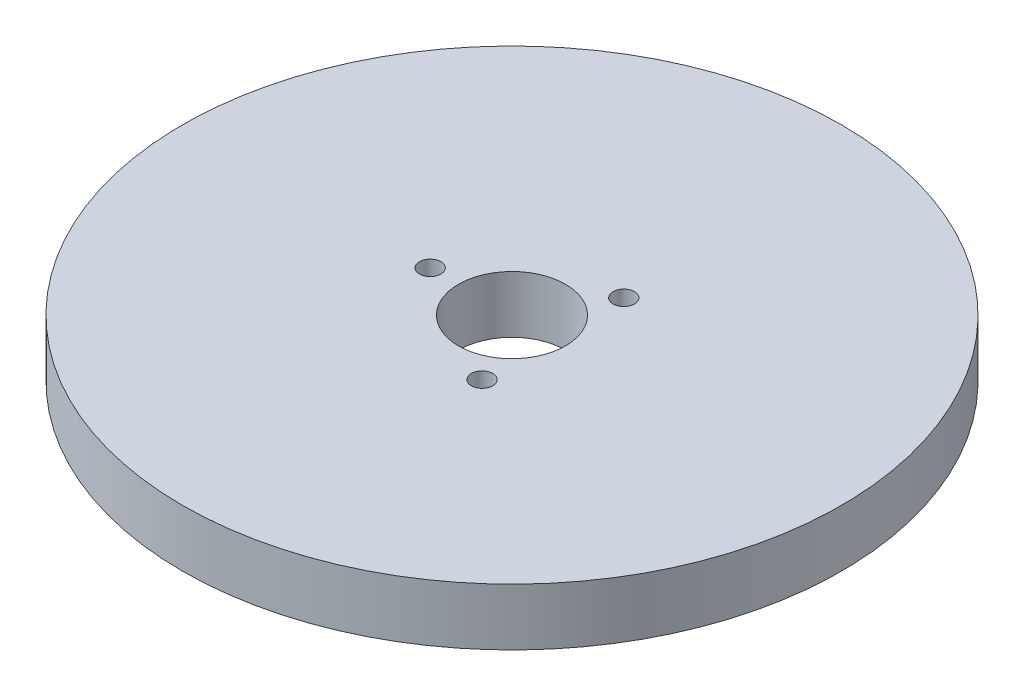
from build123d import *

# Parameters (mm, degrees)
SKETCH1_R           = 92.5
BOSS_EXTRUDE1_DEPTH = 16
SKETCH2_R           = 15
CUT_EXTRUDE1_DEPTH  = 132.789605053
SKETCH3_R           = 3.005948232
CUT_EXTRUDE2_DEPTH  = 10.477475489
CIRPATTERN1_COUNT   = 3


with BuildPart() as part:
    # Sketch1 → Boss-Extrude1 (new body)
    with BuildSketch(Plane(origin=(0, 0, 0), x_dir=(1, 0, 0), z_dir=(0, 1, 0))):
        Circle(SKETCH1_R)
    extrude(amount=BOSS_EXTRUDE1_DEPTH)

    # Sketch2 → Cut-Extrude1 (cut, through all)
    with BuildSketch(Plane(origin=(0, 0, 0), x_dir=(1, 0, 0), z_dir=(0, 1, 0))):
        Circle(SKETCH2_R)
    extrude(amount=CUT_EXTRUDE1_DEPTH, mode=Mode.SUBTRACT)

    # Sketch3 → Cut-Extrude2 (cut)
    with BuildSketch(Plane(origin=(0, 16, 0), x_dir=(1, 0, 0), z_dir=(0, 1, 0))):
        with Locations((-22.963576987, 0)):
            Circle(SKETCH3_R)
    cut_extrude2 = extrude(amount=-CUT_EXTRUDE2_DEPTH, mode=Mode.SUBTRACT)

    # CirPattern1: Cut-Extrude2 ×3 about axis
    cirpattern1_axis = Axis((0, 0, 0), (0, 1, 0))
    for i in range(1, CIRPATTERN1_COUNT):
        add(cut_extrude2.rotate(cirpattern1_axis, i * 360 / CIRPATTERN1_COUNT), mode=Mode.SUBTRACT)


solid = part.part
